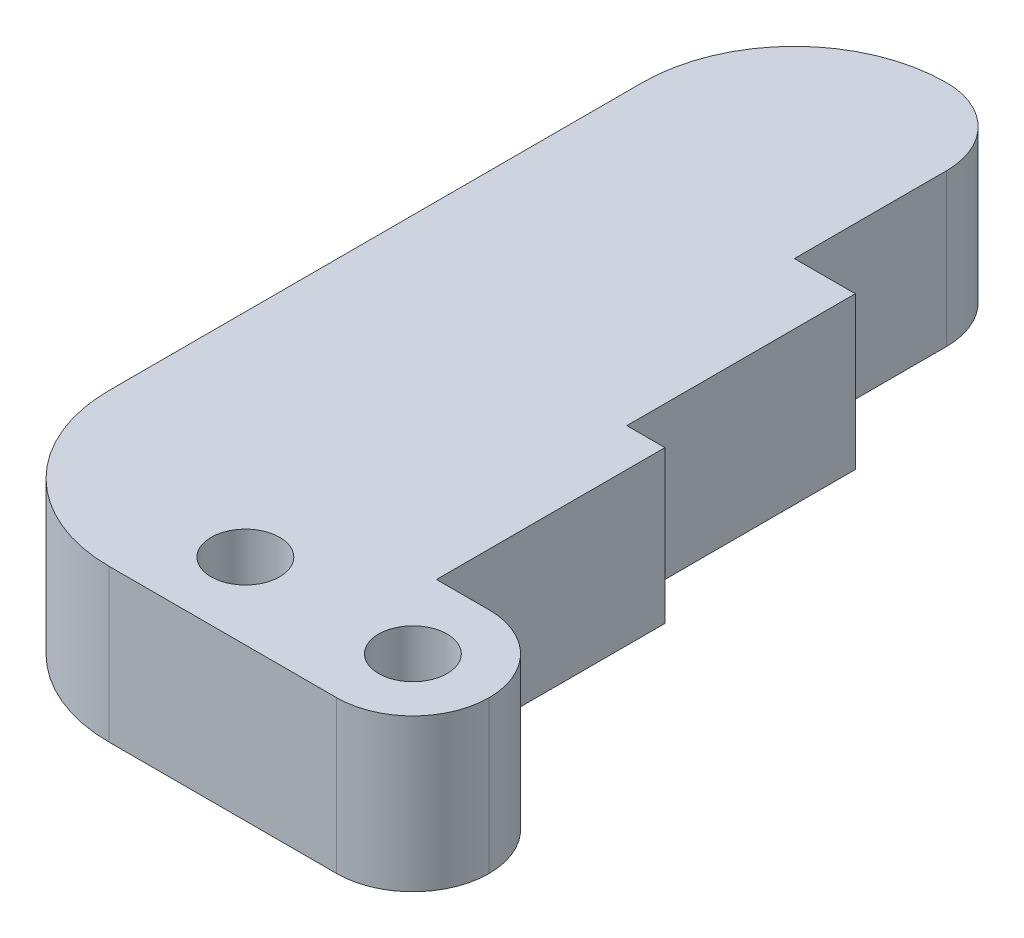
from build123d import *

# Parameters (mm, degrees)
BOSS_EXTRUDE1_DEPTH = 10
SKETCH3_R           = 2.25
CUT_EXTRUDE1_DEPTH  = 10
FILLET1_R           = 10
FILLET2_R           = 5


with BuildPart() as part:
    # Sketch2 → Boss-Extrude1 (new body)
    with BuildSketch(Plane(origin=(0, 0, 0), x_dir=(1, 0, 0), z_dir=(0, 1, 0))):
        Polygon((-8.45, 15), (-8.45, 0), (0, 0), (0, -10), (-29.95, -10), (-29.95, 45), (-14.95, 45), (-14.95, 30), (-10.95, 30), (-10.95, 15), align=None)
    extrude(amount=BOSS_EXTRUDE1_DEPTH)

    # Sketch3 → Cut-Extrude1 (cut)
    with BuildSketch(Plane(origin=(0, 10, 0), x_dir=(1, 0, 0), z_dir=(0, 1, 0))):
        with Locations(Location((-16, -5, 0), (0, 0, 270))):
            Circle(SKETCH3_R)
        with Locations(Location((-5, -5, 0), (0, 0, 270))):
            Circle(SKETCH3_R)
    extrude(amount=-CUT_EXTRUDE1_DEPTH, mode=Mode.SUBTRACT)

    # Fillet1
    fillet1_edges = [part.edges().sort_by_distance(p)[0] for p in [
        (-29.95, 5, 10),
        (-29.95, 5, -45),
    ]]
    fillet(fillet1_edges, radius=FILLET1_R)

    # Fillet2
    fillet2_edges = [part.edges().sort_by_distance(p)[0] for p in [
        (-14.95, 5, -45),
        (0, 5, 0),
        (0, 5, 10),
    ]]
    fillet(fillet2_edges, radius=FILLET2_R - 0.0001)  # a hair under: the kernel refuses the full size


solid = part.part
